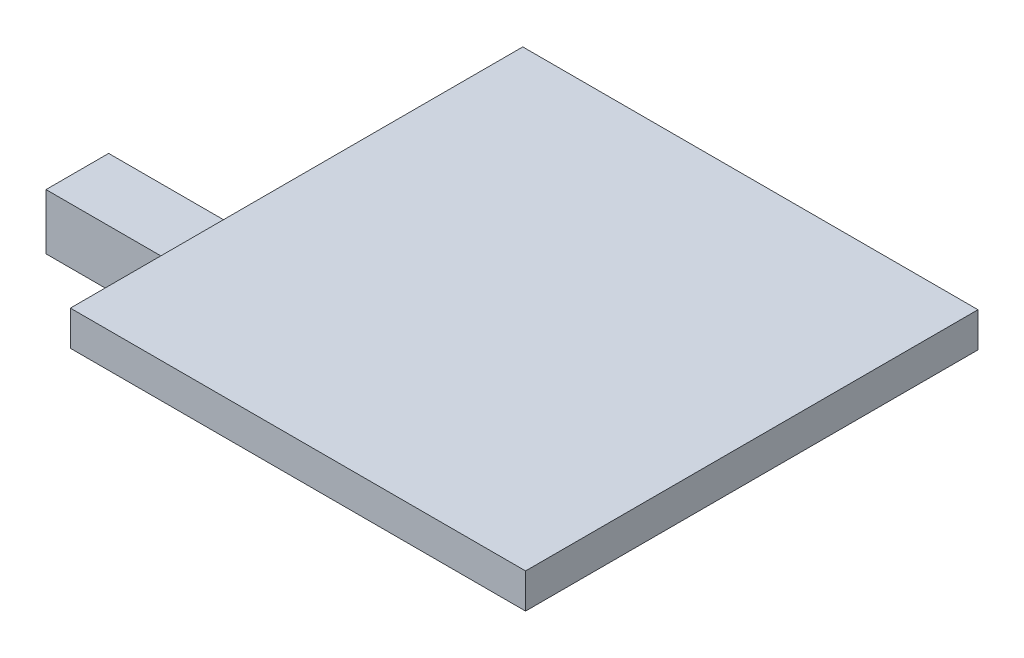
from build123d import *

# Parameters (mm, degrees)
SKETCH1_W           = 130.8
SKETCH1_H           = 10
BOSS_EXTRUDE1_DEPTH = 130
SKETCH3_W           = 10
SKETCH3_H           = 18
BOSS_EXTRUDE2_DEPTH = 16
SKETCH4_W           = 18
SKETCH4_H           = 16
BOSS_EXTRUDE3_DEPTH = 43
SKETCH5_W           = 8
SKETCH5_H           = 16
BOSS_EXTRUDE4_DEPTH = 10
SKETCH6_W           = 8
SKETCH6_H           = 16
BOSS_EXTRUDE5_DEPTH = 10
SKETCH7_W           = 2
SKETCH7_H           = 16
CUT_EXTRUDE1_DEPTH  = 20


with BuildPart() as part:
    # Sketch1 → Boss-Extrude1 (new body)
    with BuildSketch(Plane.XY):
        with Locations((-0.193522267, -13.011336032)):
            Rectangle(SKETCH1_W, SKETCH1_H)
    extrude(amount=BOSS_EXTRUDE1_DEPTH)

    # Sketch3 → Boss-Extrude2 (add)
    with BuildSketch(Plane.XZ.offset(18.011336032)):
        with Locations((-60.593522267, 85)):
            Rectangle(SKETCH3_W, SKETCH3_H)
    extrude(amount=BOSS_EXTRUDE2_DEPTH)

    # Sketch4 → Boss-Extrude3 (add)
    with BuildSketch(Plane.ZY.offset(65.593522267)):
        with Locations((85, -26.011336032)):
            Rectangle(SKETCH4_W, SKETCH4_H)
    extrude(amount=BOSS_EXTRUDE3_DEPTH)

    # Sketch5 → Boss-Extrude4 (add)
    with BuildSketch(Plane.XY.offset(94)):
        with Locations((-61.593522267, -26.011336032)):
            Rectangle(SKETCH5_W, SKETCH5_H)
    extrude(amount=BOSS_EXTRUDE4_DEPTH)

    # Sketch6 → Boss-Extrude5 (add)
    with BuildSketch(Plane(origin=(0, 0, 76), x_dir=(-1, 0, 0), z_dir=(0, 0, -1))):
        with Locations((61.593522267, -26.011336032)):
            Rectangle(SKETCH6_W, SKETCH6_H)
    extrude(amount=BOSS_EXTRUDE5_DEPTH)

    # Sketch7 → Cut-Extrude1 (cut)
    with BuildSketch(Plane(origin=(0, 0, 76), x_dir=(-1, 0, 0), z_dir=(0, 0, -1))):
        with Locations((56.593522267, -26.011336032)):
            Rectangle(SKETCH7_W, SKETCH7_H)
    extrude(amount=-CUT_EXTRUDE1_DEPTH, mode=Mode.SUBTRACT)


solid = part.part
